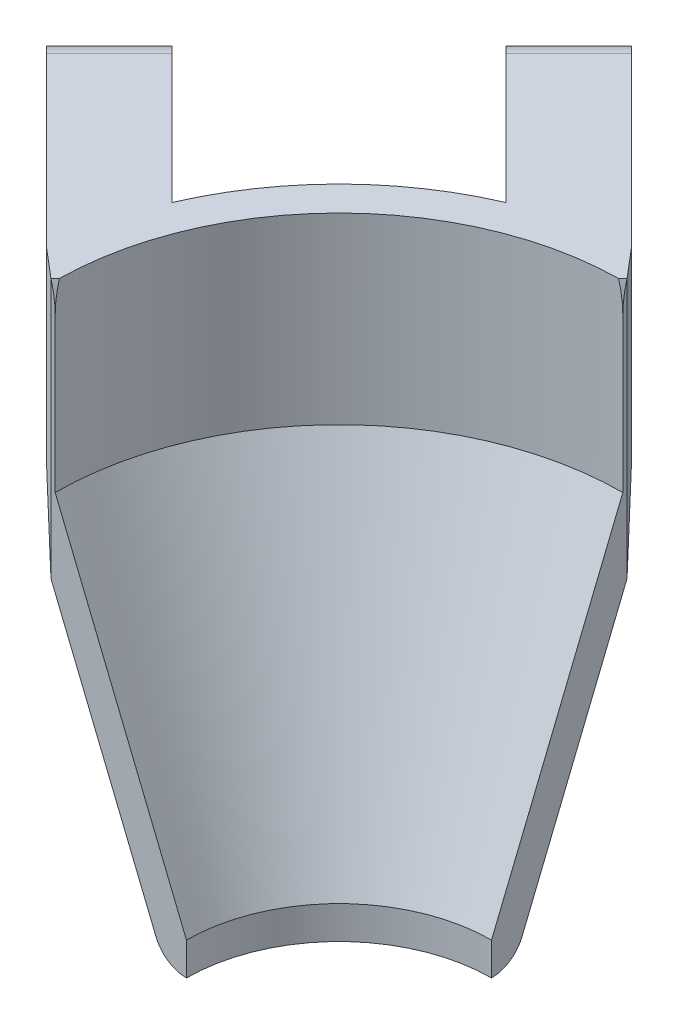
from build123d import *

# Parameters (mm, degrees)
REVOLUCI_N1_ANGLE       = 90
SALIENTE_EXTRUIR1_START = -10
SALIENTE_EXTRUIR1_DEPTH = 10
REDONDEO1_R             = 6
CROQUIS5_R              = 3
CORTAR_EXTRUIR1_DEPTH   = 156.393050206
REDONDEO2_R             = 5
CORTAR_EXTRUIR3_DEPTH   = 157.140962122
CORTAR_EXTRUIR4_DEPTH   = 152.400132213


with BuildPart() as part:
    # Croquis3 → Revolución1 (revolve)
    with BuildSketch(Plane(origin=(0, 0, 0), x_dir=(0, 0, -1), z_dir=(1, 0, 0))):
        with BuildLine():
            Line((25.795554958, 0), (25.795554958, 5.555717972))
            Line((25.795554958, 5.555717972), (48, 60))
            Line((48, 60), (48, 91))
            Line((48, 91), (54, 91))
            Line((54, 91), (54, 60))
            Line((54, 60), (30.939888656, 3.457663399))
            ThreePointArc((30.939888656, 3.457663399), (28.894732485, 0.944741845), (25.795554958, 0))
        make_face()
    revolve(axis=Axis((0, 0, 0), (0, 1, 0)), revolution_arc=REVOLUCI_N1_ANGLE)

    # Croquis4 → Saliente-Extruir1 (add)
    with BuildSketch(Plane(origin=(0, 91, 0), x_dir=(1, 0, 0), z_dir=(0, 1, 0)).offset(SALIENTE_EXTRUIR1_START)):
        with BuildLine():
            Line((-85.559920524, 36.062445841), (-74.953318806, 46.669047558))
            Line((-74.953318806, 46.669047558), (-49.610431326, 21.326160078))
            ThreePointArc((-49.610431326, 21.326160078), (-52.411957015, 12.999490829), (-53.826220039, 4.328745356))
            Line((-53.826220039, 4.328745356), (-85.559920524, 36.062445841))
        make_face()
        with BuildLine():
            Line((-46.669047558, 74.953318806), (-21.326160078, 49.610431326))
            ThreePointArc((-21.326160078, 49.610431326), (-12.999490829, 52.411957015), (-4.328745356, 53.826220039))
            Line((-4.328745356, 53.826220039), (-36.062445841, 85.559920524))
            Line((-36.062445841, 85.559920524), (-46.669047558, 74.953318806))
        make_face()
    extrude(amount=SALIENTE_EXTRUIR1_DEPTH)

    # Redondeo1
    redondeo1_edges = [part.edges().sort_by_distance(p)[0] for p in [
        (-52.411957015, 81, -12.999490829),
        (-12.999490829, 81, -52.411957015),
    ]]
    fillet(redondeo1_edges, radius=REDONDEO1_R)

    # Croquis5 → Cortar-Extruir1 (cut, through all)
    with BuildSketch(Plane(origin=(-24.748737342, 0, 24.748737342), x_dir=(0.707106781186549, 0, 0.707106781186546), z_dir=(-0.707106781186546, 0, 0.707106781186549))):
        with Locations((-59, 86)):
            Circle(CROQUIS5_R)
        with Locations((-78, 86)):
            Circle(CROQUIS5_R)
    extrude(amount=-CORTAR_EXTRUIR1_DEPTH, mode=Mode.SUBTRACT)

    # Redondeo2
    redondeo2_edges = [part.edges().sort_by_distance(p)[0] for p in [
        (-80.256619665, 81, -41.365746699),
        (-41.365746699, 81, -80.256619665),
        (-80.256619665, 91, -41.365746699),
        (-41.365746699, 91, -80.256619665),
    ]]
    fillet(redondeo2_edges, radius=REDONDEO2_R - 0.0001)  # a hair under: the kernel refuses the full size

    # Croquis14 → Cortar-Extruir3 (cut, through all)
    with BuildSketch(Plane(origin=(27, 0, -27), x_dir=(-0.7071067811865492, 0, -0.7071067811865458), z_dir=(0.7071067811865458, 0, -0.7071067811865492))):
        with BuildLine():
            Line((34.445016975, 91), (33.941125497, 91))
            Line((33.941125497, 91), (33.941125497, 86))
            ThreePointArc((33.941125497, 86), (34.067416606, 88.512663259), (34.445016975, 91))
        make_face()
    extrude(amount=-CORTAR_EXTRUIR3_DEPTH, mode=Mode.SUBTRACT)

    # Croquis17 → Cortar-Extruir4 (cut, through all)
    with BuildSketch(Plane(origin=(0, 91, 0), x_dir=(1, 0, 0), z_dir=(0, 1, 0))):
        with BuildLine():
            Line((-4.328745356, 53.826220039), (0, 48.712610162))
            Line((0, 48.712610162), (0, 54))
            ThreePointArc((0, 54), (-2.1661161, 53.956537519), (-4.328745356, 53.826220039))
        make_face()
        with BuildLine():
            Line((-53.826220039, 4.328745356), (-48.712610162, 0))
            Line((-48.712610162, 0), (-54, 0))
            ThreePointArc((-54, 0), (-53.956537519, 2.1661161), (-53.826220039, 4.328745356))
        make_face()
    extrude(amount=-CORTAR_EXTRUIR4_DEPTH, mode=Mode.SUBTRACT)


solid = part.part
